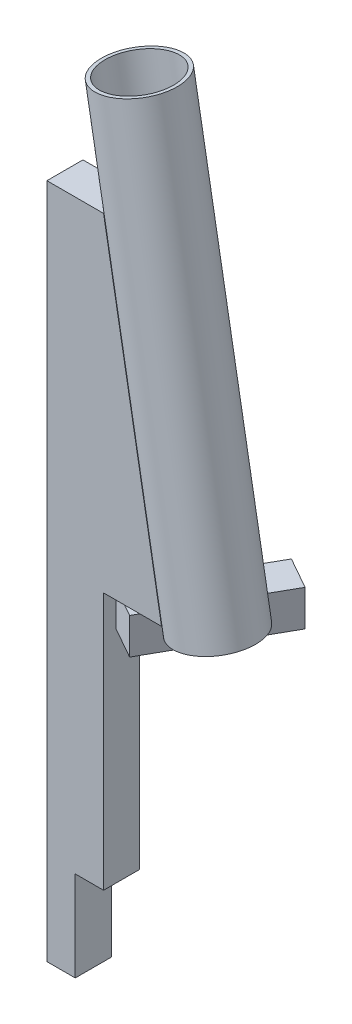
from build123d import *

# Parameters (mm, degrees)
MAIN_EXTRUSION_DEPTH = 14
LOCK_EXTRUSION_DEPTH = 28
ESQUISSE3_R          = 30
ESQUISSE3_R_2        = 27
PLEXIGLAS_DEPTH      = 350


with BuildPart() as part:
    # Esquisse1 → Main Extrusion (new, symmetric)
    with BuildSketch(Plane.XY):
        Polygon((0, 525.207681883), (0, 0), (22, 0), (22, 70), (44, 70), (44, 270), (89, 270), (44, 525.207681883), align=None)
    extrude(amount=MAIN_EXTRUSION_DEPTH, both=True)

    # Esquisse2 → Lock Extrusion (add)
    with BuildSketch(Plane(origin=(0, 270, 0), x_dir=(-1, 0, 0), z_dir=(0, -1, 0))):
        Polygon((-69.304044708, -19.075301039), (-118.487103034, 67.993790915), (-94.107757287, 81.765047246), (-44.924698961, -5.304044708), align=None)
    extrude(amount=LOCK_EXTRUSION_DEPTH)


with BuildPart() as body_2:
    # Esquisse3 → Plexiglas (new body)
    with BuildSketch(Plane(origin=(-43.489040974, 246.638607428, 0), x_dir=(0, 0, -1), z_dir=(0.1736481776669273, -0.9848077530122086, 0))):
        with Locations((0, 164.532897988)):
            Circle(ESQUISSE3_R)
        with Locations((0, 164.532897988)):
            Circle(ESQUISSE3_R_2, mode=Mode.SUBTRACT)
    extrude(amount=-PLEXIGLAS_DEPTH)


solid = Compound([part.part, body_2.part])
